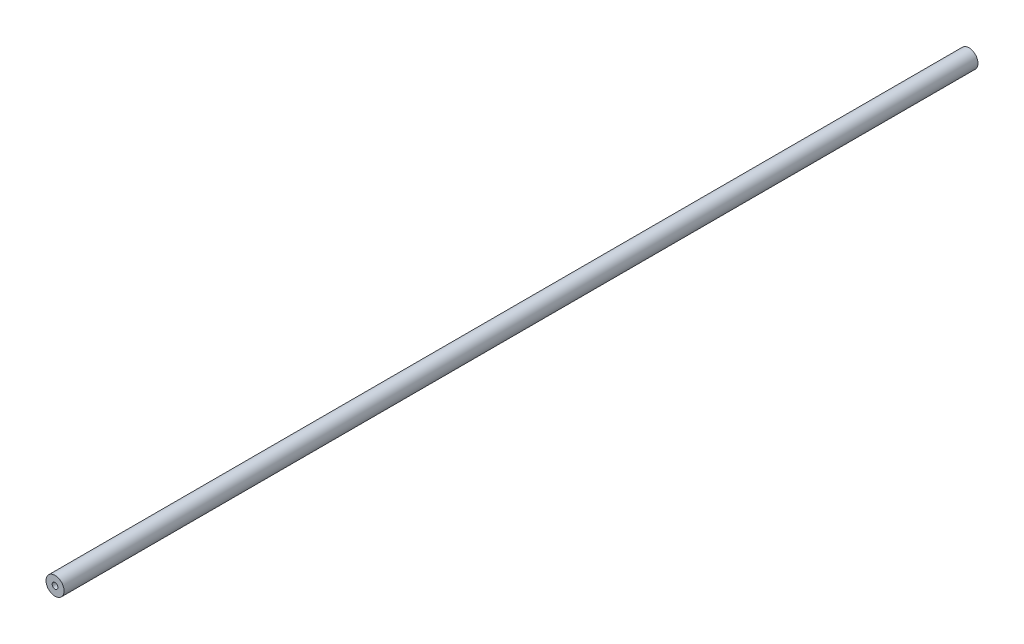
from build123d import *

# Parameters (mm, degrees)
SKETCH1_R                  = 6.35
BOSS_EXTRUDE1_DEPTH        = 641.858
F_10_32_TAPPED_HOLE1_D     = 4.0386
F_10_32_TAPPED_HOLE1_DEPTH = 13.716
F_10_32_TAPPED_HOLE1_TIP   = 1.213317848
F_10_32_TAPPED_HOLE2_D     = 4.0386
F_10_32_TAPPED_HOLE2_DEPTH = 13.716
F_10_32_TAPPED_HOLE2_TIP   = 1.213317848


with BuildPart() as part:
    # Sketch1 → Boss-Extrude1 (new body)
    with BuildSketch(Plane.XY):
        Circle(SKETCH1_R)
    extrude(amount=BOSS_EXTRUDE1_DEPTH)

    # #10-32 Tapped Hole1
    with Locations(Plane.XY.offset(641.858)):
        with Locations((0, 0)):
            Hole(F_10_32_TAPPED_HOLE1_D / 2, depth=F_10_32_TAPPED_HOLE1_DEPTH)
            with Locations((0, 0, -(F_10_32_TAPPED_HOLE1_DEPTH + F_10_32_TAPPED_HOLE1_TIP / 2))):  # 118° drill point
                Cone(0, F_10_32_TAPPED_HOLE1_D / 2, F_10_32_TAPPED_HOLE1_TIP, mode=Mode.SUBTRACT)

    # #10-32 Tapped Hole2
    with Locations(Plane(origin=(0, 0, 0), x_dir=(-1, 0, 0), z_dir=(0, 0, -1))):
        with Locations((0, 0)):
            Hole(F_10_32_TAPPED_HOLE2_D / 2, depth=F_10_32_TAPPED_HOLE2_DEPTH)
            with Locations((0, 0, -(F_10_32_TAPPED_HOLE2_DEPTH + F_10_32_TAPPED_HOLE2_TIP / 2))):  # 118° drill point
                Cone(0, F_10_32_TAPPED_HOLE2_D / 2, F_10_32_TAPPED_HOLE2_TIP, mode=Mode.SUBTRACT)


solid = part.part
